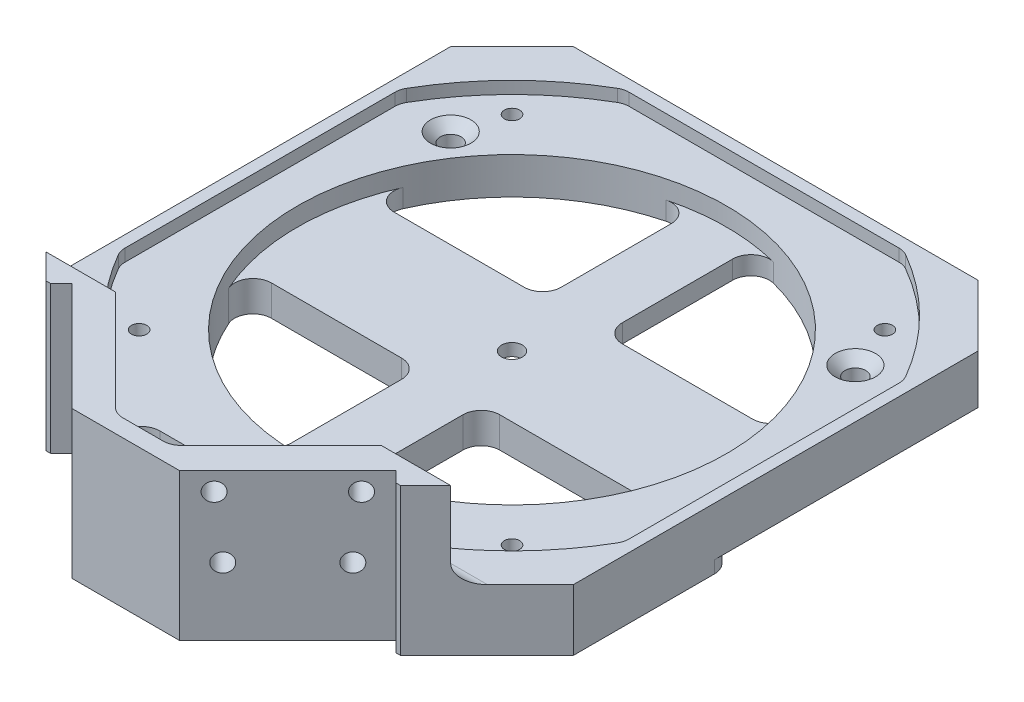
from build123d import *

# Parameters (mm, degrees)
EXTRUDE_1_DEPTH             = 10
CUT_EXTRUDE_1_DEPTH         = 2
CUT_EXTRUDE_2_DEPTH         = 2
SKETCH_4_R                  = 35.00000000000001
CUT_EXTRUDE_3_DEPTH         = 3
CUT_EXTRUDE_4_DEPTH         = 62.016391240387215
HOLE_WIZARD_M3_1_D          = 2.5
HOLE_WIZARD_1_D             = 3.4
HOLE_WIZARD_1_CSINK_D       = 6.6
HOLE_WIZARD_1_CSINK_ANGLE   = 90
SKETCH_11_R                 = 4.000000000000005
SKETCH_11_R_2               = 3.999999999999999
SKETCH_11_R_3               = 4
CUT_EXTRUDE_5_DEPTH         = 1
CHAMFER_1_SIZE              = 10
EXTRUDE_2_DEPTH             = 14
EXTRUDE_2_DIRECTION_2_REACH = 63.628
SKETCH_13_R                 = 1.5000000000000009
SKETCH_13_R_2               = 1.5000000000000042
CUT_EXTRUDE_6_DEPTH         = 8
SKETCH_13_3_R               = 1.5000000000000009
SKETCH_13_3_R_2             = 1.5000000000000042
CUT_EXTRUDE_7_DEPTH         = 3
MIRROR_START                = 45.74011537
MIRROR_6_OUTLINE_R          = 1.5
MIRROR_6_DEPTH              = 5
CUT_EXTRUDE_8_DEPTH         = 83.20937791832523
FILLET_1_R                  = 3
FILLET_2_R                  = 3
FILLET_5_R                  = 3
CHAMFER_2_SIZE              = 0.5


# Read off the part's stored shape, not the designer's step: 镜向6
with BuildPart() as part:
    # 草图1 → 凸台-拉伸1 (new body)
    with BuildSketch(Plane(origin=(0, 0, 0), x_dir=(1, 0, 0), z_dir=(0, 1, 0))):
        Polygon((-43, 43), (42.999999999999986, 43), (43, -42.99999999999999), (-43, -42.99999999999999), align=None)
    extrude(amount=EXTRUDE_1_DEPTH)

    # 草图2 → 切除-拉伸1 (cut)
    with BuildSketch(Plane.XZ):
        Polygon((42.99999999999999, 7.000000000000008), (-43, 7.000000000000008), (-43, -43), (43, -43), align=None)
    extrude(amount=-CUT_EXTRUDE_1_DEPTH, mode=Mode.SUBTRACT)

    # 草图3 → 切除-拉伸2 (cut)
    with BuildSketch(Plane(origin=(0, 10, 0), x_dir=(1, 0, 0), z_dir=(0, 1, 0))):
        with BuildLine():
            Line((-24.686291501015234, -42.99999999999999), (24.686291501015248, -42.999999999999986))
            Line((24.686291501015244, -42.999999999999986), (24.686291501015237, -39.994837315919945))
            ThreePointArc((24.686291501015248, -39.99483731591996), (33.99829514057673, -32.45174768073728), (41.099999999999305, -22.79890348240587))
            Line((41.10000000000001, -22.798903482406033), (41.1, 22.798903482403997))
            ThreePointArc((41.10000000000031, 22.798903482404068), (33.23401871576778, 33.234018715767704), (22.79890348240416, 41.10000000000025))
            Line((22.798903482404093, 41.099999999999994), (-22.798903482403766, 41.099999999999994))
            ThreePointArc((-22.798903482403876, 41.1000000000004), (-33.23401871576702, 33.23401871576845), (-41.099999999999426, 22.798903482405624))
            Line((-41.1, 22.798903482405752), (-41.099999999999994, -22.798903482407027))
            ThreePointArc((-41.09999999999881, -22.798903482406732), (-33.99829514057638, -32.45174768073764), (-24.68629150101524, -39.99483731591995))
            Line((-24.686291501015234, -39.994837315919945), (-24.686291501015234, -42.99999999999999))
        make_face()
    extrude(amount=-CUT_EXTRUDE_2_DEPTH, mode=Mode.SUBTRACT)

    # 草图4 → 切除-拉伸3 (cut)
    with BuildSketch(Plane(origin=(0, 8, 0), x_dir=(1, 0, 0), z_dir=(0, 1, 0))):
        with Locations(Location((0, 0, 0), (0, 0, 270))):
            Circle(SKETCH_4_R)
    extrude(amount=-CUT_EXTRUDE_3_DEPTH, mode=Mode.SUBTRACT)

    # 草图5 → 切除-拉伸4 (cut, through all)
    with BuildSketch(Plane(origin=(0, 5, 0), x_dir=(1, 0, 0), z_dir=(0, 1, 0))):
        with BuildLine():
            Line((-4.999999999999996, 9.999999999999993), (-4.999999999999998, 34.64101615137756))
            ThreePointArc((-5, 34.64101615137755), (-22.872417196250915, 26.49249953478618), (-33.54101966249686, 9.999999999999986))
            Line((-33.54101966249684, 9.999999999999977), (-4.999999999999996, 9.999999999999993))
        make_face()
        with BuildLine():
            ThreePointArc((33.54101966249686, 9.999999999999986), (22.87241719625092, 26.492499534786173), (5.0000000000000036, 34.64101615137755))
            Line((5.000000000000002, 34.64101615137756), (5.000000000000006, 9.999999999999993))
            Line((5.000000000000006, 9.999999999999995), (33.54101966249686, 9.999999999999986))
        make_face()
        with BuildLine():
            Line((-4.99999999999999, -9.999999999999996), (-33.54101966249684, -9.999999999999995))
            ThreePointArc((-33.54101966249685, -9.999999999999993), (-22.87241719625092, -26.492499534786173), (-4.999999999999993, -34.64101615137755))
            Line((-4.999999999999981, -34.64101615137756), (-4.99999999999999, -9.999999999999996))
        make_face()
        with BuildLine():
            ThreePointArc((5.000000000000011, -34.64101615137755), (22.87241719625091, -26.49249953478618), (33.54101966249685, -9.999999999999991))
            Line((33.54101966249686, -9.999999999999986), (5.000000000000006, -9.999999999999995))
            Line((5.000000000000006, -9.999999999999993), (5.000000000000002, -34.64101615137756))
        make_face()
    extrude(amount=-CUT_EXTRUDE_4_DEPTH, mode=Mode.SUBTRACT)

    # M3 螺纹孔1 (through all)
    with Locations(Plane(origin=(0, 8, 0), x_dir=(1, 0, 0), z_dir=(0, 1, 0))):
        with Locations((-30.405591591, 30.405591591), (30.405591591, 30.405591591), (30.405591591, -30.405591591), (-30.405591591, -30.405591591)):
            Hole(HOLE_WIZARD_M3_1_D / 2)

    # 打孔尺寸(%根据十字)槽沉头木螺钉的类型1 (through all)
    with Locations(Plane(origin=(0, 8, 0), x_dir=(1, 0, 0), z_dir=(0, 1, 0))):
        with Locations((-33, 23), (33, 23), (0, 0)):
            CounterSinkHole(HOLE_WIZARD_1_D / 2, HOLE_WIZARD_1_CSINK_D / 2, counter_sink_angle=HOLE_WIZARD_1_CSINK_ANGLE)

    # 草图11 → 切除-拉伸5 (cut)
    with BuildSketch(Plane.XZ.offset(-2)):
        with Locations(Location((33, -23.000000000000007, 0), (0, 0, 270))):
            Circle(SKETCH_11_R)
        with Locations(Location((-33, -23, 0), (0, 0, 270))):
            Circle(SKETCH_11_R_2)
        with Locations(Location((0, 0, 0), (0, 0, 270))):
            Circle(SKETCH_11_R_3)
    extrude(amount=-CUT_EXTRUDE_5_DEPTH, mode=Mode.SUBTRACT)

    # 倒角1
    chamfer_1_edges = [part.edges().sort_by_distance(p)[0] for p in [
        (43, 5, 42.99999999999999),
        (-43, 5, 42.99999999999999),
        (-43, 6, -43),
        (42.999999999999986, 6, -43),
    ]]
    chamfer(chamfer_1_edges, length=CHAMFER_1_SIZE)

    # 草图12 → 凸台-拉伸2 (add)
    with BuildSketch(Plane(origin=(0, 10, 0), x_dir=(1, 0, 0), z_dir=(0, 1, 0))):
        Polygon((-21.68629150101517, -42.99999999999999), (-32.999999999999986, -42.99999999999999), (-10.171572875253744, -65.82842712474618), (10.171572875253764, -65.82842712474618), (32.999999999999986, -42.99999999999999), (21.68629150101517, -42.99999999999999), (4.514718625761375, -60.17157287525379), (-4.51471862576136, -60.17157287525379), align=None)
    extrude(amount=EXTRUDE_2_DEPTH)

    # 凸台-拉伸2 direction 2: up to this face of the body (flat: up to its plane)
    extrude_2_direction_2_end = Plane(part.part.faces().sort_by_distance((0, 0, 26.766223415))[0])
    # 草图12 → 凸台-拉伸2 direction 2 (add, up to the picked face)
    with BuildSketch(Plane(origin=(0, 10, 0), x_dir=(1, 0, 0), z_dir=(0, 1, 0)), mode=Mode.PRIVATE) as extrude_2_direction_2_sk1:
        Polygon((-21.68629150101517, -42.99999999999999), (-32.999999999999986, -42.99999999999999), (-10.171572875253744, -65.82842712474618), (10.171572875253764, -65.82842712474618), (32.999999999999986, -42.99999999999999), (21.68629150101517, -42.99999999999999), (4.514718625761375, -60.17157287525379), (-4.51471862576136, -60.17157287525379), align=None)
    extrude_2_direction_2_tool1 = split(extrude(extrude_2_direction_2_sk1.sketch, amount=-EXTRUDE_2_DIRECTION_2_REACH, mode=Mode.PRIVATE), bisect_by=extrude_2_direction_2_end, keep=Keep.BOTH, mode=Mode.PRIVATE)
    add(extrude_2_direction_2_tool1.solids().sort_by(Axis((-13.594324, 10, 52.079605), (0, -1, 0)))[0])

    # 草图13 → 切除-拉伸6 (cut)
    with BuildSketch(Plane(origin=(-38.00000000000007, 0, 37.999999999999886), x_dir=(0.7071067811865458, 0, 0.7071067811865492), z_dir=(-0.7071067811865492, 0, 0.7071067811865458))):
        with Locations((17.35533905932751, 20.999999999999993)):
            Circle(SKETCH_13_R)
        with Locations((34.35533905932751, 20.999999999999996)):
            Circle(SKETCH_13_R_2)
        with Locations((33.35533905932751, 11)):
            Circle(SKETCH_13_R_2)
        with Locations((18.35533905932751, 10.999999999999998)):
            Circle(SKETCH_13_R)
    extrude(amount=-CUT_EXTRUDE_6_DEPTH, mode=Mode.SUBTRACT)

    # 草图13<3> → 切除-拉伸7 (cut)
    with BuildSketch(Plane(origin=(-38.00000000000007, 0, 37.999999999999886), x_dir=(0.7071067811865458, 0, 0.7071067811865492), z_dir=(-0.7071067811865492, 0, 0.7071067811865458))):
        Polygon((38.35533905932751, 24), (13.355339059327509, 23.999999999999996), (13.355339059327513, 0), (38.35533905932752, 3.06e-15), align=None)
        with Locations((18.35533905932751, 10.999999999999998)):
            Circle(SKETCH_13_3_R, mode=Mode.SUBTRACT)
        with Locations((33.35533905932751, 11)):
            Circle(SKETCH_13_3_R_2, mode=Mode.SUBTRACT)
        with Locations((17.35533905932751, 20.999999999999993)):
            Circle(SKETCH_13_3_R, mode=Mode.SUBTRACT)
        with Locations((34.35533905932751, 20.999999999999996)):
            Circle(SKETCH_13_3_R_2, mode=Mode.SUBTRACT)
    extrude(amount=-CUT_EXTRUDE_7_DEPTH, mode=Mode.SUBTRACT)

    # 镜向6 outline → 镜向6 (cut)
    with BuildSketch(Plane(origin=(0, 0, 0), x_dir=(0.707106781186546, 0, -0.707106781186549), z_dir=(0.707106781186549, 0, 0.707106781186546)).offset(MIRROR_START)):
        with Locations((-17.355339059, 21)):
            Circle(MIRROR_6_OUTLINE_R)
        with Locations((-18.355339059, 11)):
            Circle(MIRROR_6_OUTLINE_R)
        with Locations((-33.355339059, 11)):
            Circle(MIRROR_6_OUTLINE_R)
        with Locations((-34.355339059, 21)):
            Circle(MIRROR_6_OUTLINE_R)
    extrude(amount=MIRROR_6_DEPTH, mode=Mode.SUBTRACT)

    # 草图14 → 切除-拉伸8 (cut, through all)
    with BuildSketch(Plane(origin=(0, 24, 0), x_dir=(1, 0, 0), z_dir=(0, 1, 0))):
        Polygon((-2e-17, -65.82842712474616), (-1e-17, -63.00000000000004), (-8.757359312880741, -63.00000000000004), (-10.878679656440386, -65.12132034355969), (-10.171572875253748, -65.82842712474616), align=None)
        Polygon((8.757359312880741, -63.00000000000004), (0, -63.00000000000004), (-2e-17, -65.82842712474616), (10.171572875253762, -65.82842712474618), (10.878679656440323, -65.12132034355963), align=None)
        Polygon((26.435028842544384, -45.32233047033632), (8.757359312880741, -63.00000000000004), (10.878679656440386, -65.12132034355969), (28.556349186104022, -47.44365081389593), align=None)
    extrude(amount=-CUT_EXTRUDE_8_DEPTH, mode=Mode.SUBTRACT)

    # 圆角1
    fillet_1_edges = [part.edges().sort_by_distance(p)[0] for p in [
        (42.99999999999999, 1, 7.000000000000008),
        (-43, 1, 7.000000000000008),
        (33.54101966249685, 2.5, 9.99999999999999),
        (5.000000000000006, 2.5, 9.999999999999993),
        (5.000000000000007, 2.5, 34.641016151377556),
        (-4.999999999999988, 2.5, 34.641016151377556),
        (-4.99999999999999, 2.5, 9.999999999999996),
        (-33.54101966249685, 2.5, 9.999999999999993),
        (33.541019662496865, 3.5, -9.999999999999988),
        (5.000000000000006, 3.5, -9.999999999999993),
        (5.0000000000000036, 3.5, -34.641016151377556),
        (-5, 3.5, -34.641016151377556),
        (-4.999999999999996, 3.5, -9.999999999999993),
        (-33.54101966249685, 3.5, -9.999999999999982),
        (-41.0999999999994, 9, 22.798903482406878),
        (-41.09999999999971, 9, -22.798903482405688),
        (41.10000000000016, 9, -22.798903482404036),
        (41.09999999999966, 9, 22.798903482405954),
        (-22.798903482403823, 9, -41.1000000000002),
        (22.798903482404132, 9, -41.10000000000012),
        (24.686291501015248, 9, 42.999999999999986),
        (-24.686291501015234, 9, 42.99999999999999),
    ]]
    fillet(fillet_1_edges, radius=FILLET_1_R - 0.0001)  # a hair under: the kernel refuses the full size

    # 圆角2
    fillet_2_edges = [part.edges().sort_by_distance(p)[0] for p in [
        (27.34319575050762, 10, 42.99999999999999),
        (-27.34319575050762, 10, 42.99999999999999),
    ]]
    fillet(fillet_2_edges, radius=FILLET_2_R - 0.0001)  # a hair under: the kernel refuses the full size

    # 圆角5
    fillet_5_edges = [part.edges().sort_by_distance(p)[0] for p in [
        (21.68629150101517, 4, 42.99999999999999),
        (-21.68629150101517, 4, 42.99999999999999),
        (-4.514718625761361, 12, 60.17157287525379),
        (4.514718625761375, 12, 60.17157287525379),
    ]]
    fillet(fillet_5_edges, radius=FILLET_5_R)

    # 倒角2
    chamfer_2_edges = [part.edges().sort_by_distance(p)[0] for p in [
        (-28.556349186104043, 11.999999999999998, 47.44365081389596),
        (28.55634918610403, 11.999999999999998, 47.44365081389594),
    ]]
    chamfer(chamfer_2_edges, length=CHAMFER_2_SIZE)


solid = part.part
